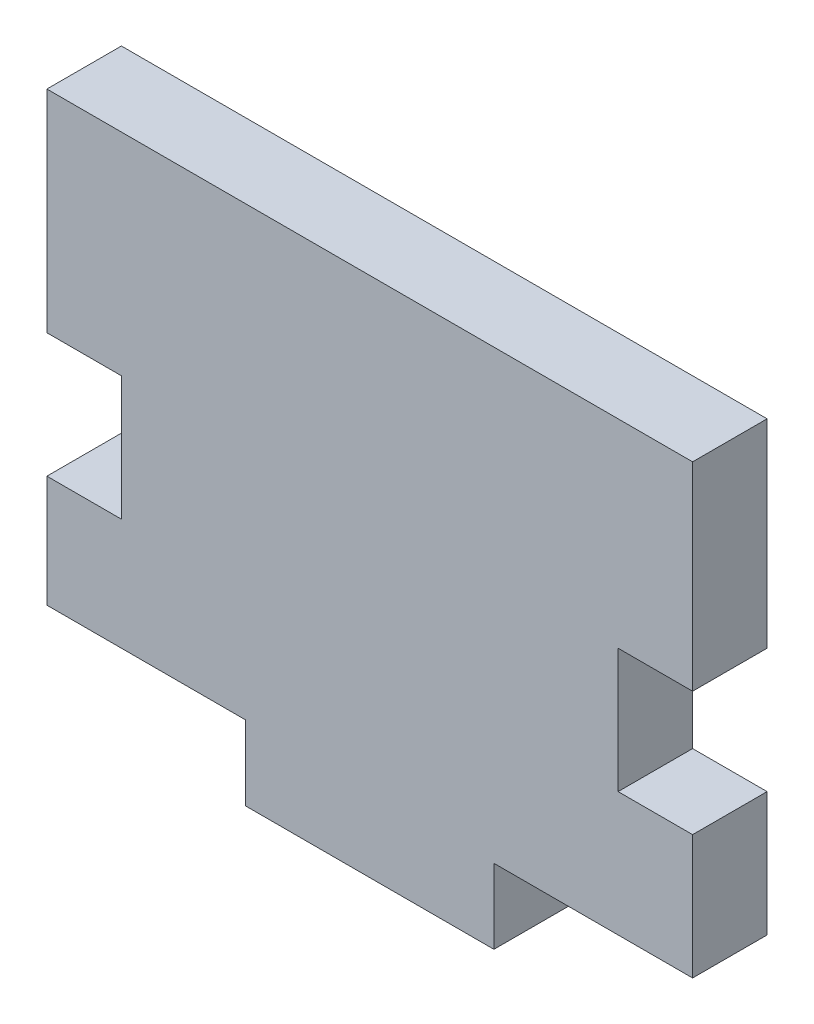
from build123d import *

# Parameters (mm, degrees)
SKETCH1_W           = 52
SKETCH1_H           = 42
BOSS_EXTRUDE1_DEPTH = 6
SKETCH2_W           = 16
SKETCH2_H           = 6
CUT_EXTRUDE1_DEPTH  = 34.955853693
SKETCH3_W           = 6
SKETCH3_H           = 10
CUT_EXTRUDE2_DEPTH  = 34.955853693


with BuildPart() as part:
    # Sketch1 → Boss-Extrude1 (new body)
    with BuildSketch(Plane.XY):
        Rectangle(SKETCH1_W, SKETCH1_H)
    extrude(amount=BOSS_EXTRUDE1_DEPTH)

    # Sketch2 → Cut-Extrude1 (cut, through all)
    with BuildSketch(Plane.XY.offset(6)):
        with Locations((-18, -18)):
            Rectangle(SKETCH2_W, SKETCH2_H)
        with Locations((18, -18)):
            Rectangle(SKETCH2_W, SKETCH2_H)
    extrude(amount=-CUT_EXTRUDE1_DEPTH, mode=Mode.SUBTRACT)

    # Sketch3 → Cut-Extrude2 (cut, through all)
    with BuildSketch(Plane(origin=(0, 0, 0), x_dir=(-1, 0, 0), z_dir=(0, 0, -1))):
        with Locations((-23, 0)):
            Rectangle(SKETCH3_W, SKETCH3_H)
        with Locations((23, -1)):
            Rectangle(SKETCH3_W, SKETCH3_H)
    extrude(amount=-CUT_EXTRUDE2_DEPTH, mode=Mode.SUBTRACT)


solid = part.part
